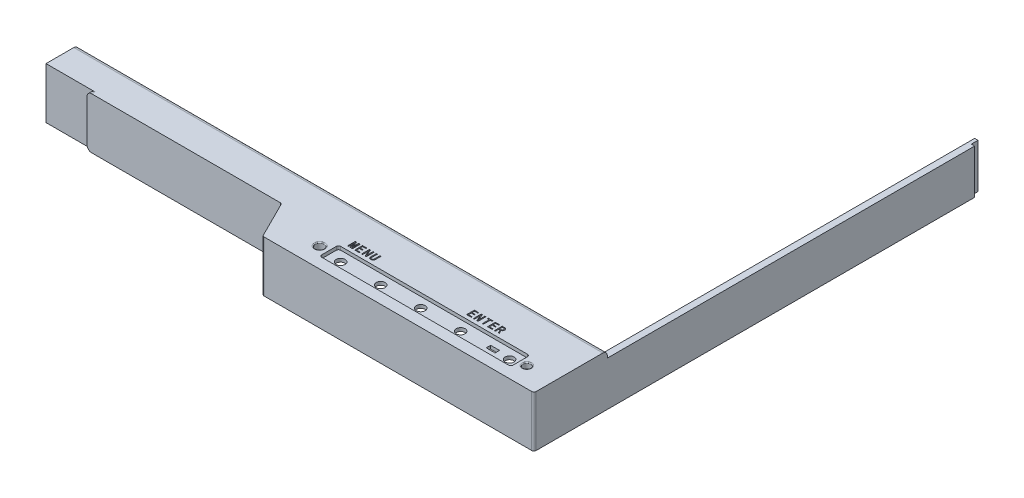
from build123d import *

# Parameters (mm, degrees)
SKETCH_2_W           = 614.8
SKETCH_2_H           = 187.25
SKETCH_2_W_2         = 608.8
SKETCH_2_H_2         = 181.25
EXTRUDE_2_DEPTH      = 20
EXTRUDE_START        = -20
EXTRUDE_3_DEPTH      = 20
EXTRUDE_1_DEPTH      = 3
FILLET_1_R           = 2
CUT_EXTRUDE_5_DEPTH  = 20
SKETCH_11_W          = 614.8
SKETCH_11_H          = 20
CUT_EXTRUDE_6_DEPTH  = 3
SKETCH_12_W          = 14.7
SKETCH_12_H          = 24.983883295
SKETCH_12_R          = 1.525
EXTRUDE_2_2_DEPTH    = 3
SKETCH_13_R          = 3
CUT_EXTRUDE_7_DEPTH  = 1
SKETCH_14_R          = 3
CUT_EXTRUDE_8_DEPTH  = 1
FILLET_2_R           = 1
CUT_EXTRUDE_9_REACH  = 367.952
SKETCH_15_R          = 2
SKETCH_15_R_2        = 1.75
FILLET_3_R           = 0.4
CUT_EXTRUDE_10_DEPTH = 0.5
SKETCH_17_W          = 307.4
SKETCH_17_H          = 31.646239737
CUT_EXTRUDE_11_DEPTH = 369.137640844
SKETCH_18_W          = 1.5
SKETCH_18_H          = 3
CUT_EXTRUDE_12_DEPTH = 366.951858311
FILLET_4_R           = 1
FILLET_6_R           = 1
SKETCH_20_W          = 4
SKETCH_20_H          = 2
CUT_EXTRUDE_14_DEPTH = 2
SKETCH_21_W          = 110
SKETCH_21_H          = 10
CUT_EXTRUDE_15_DEPTH = 0.5
SKETCH_22_W          = 86
SKETCH_22_H          = 8.509363598
CUT_EXTRUDE_16_DEPTH = 1.5
FILLET_7_R           = 1
SKETCH_23_W          = 69.4
SKETCH_23_H          = 23
CUT_EXTRUDE_17_DEPTH = 20
SKETCH_24_W          = 20
SKETCH_24_H          = 23
CUT_EXTRUDE_18_DEPTH = 1.5
FILLET_8_R           = 2


# Read off the part's stored shape, not the designer's step: 拉伸-薄壁3
with BuildPart() as part:
    # 草图2 → Extrude 2 (new body)
    with BuildSketch(Plane(origin=(0, 0, 0), x_dir=(1, 0, 0), z_dir=(0, 1, 0))):
        with Locations((0, -86.925)):
            Rectangle(SKETCH_2_W, SKETCH_2_H)
        with Locations((0, -86.925)):
            Rectangle(SKETCH_2_W_2, SKETCH_2_H_2, mode=Mode.SUBTRACT)
    extrude(amount=EXTRUDE_2_DEPTH)

    # 拉伸-薄壁3 outline → 拉伸-薄壁3 (add)
    with BuildSketch(Plane(origin=(0, 20, 0), x_dir=(1, 0, 0), z_dir=(0, 1, 0)).offset(EXTRUDE_START)):
        Polygon((304.4, -180.55), (304.4, -194.55), (187.254101966, -194.55), (180.254101966, -180.55), (176.9, -180.55), (185.4, -197.55), (307.4, -197.55), (307.4, -180.55), align=None)
    extrude(amount=EXTRUDE_3_DEPTH)

    # 草图8 → 凸台-拉伸1 (add)
    with BuildSketch(Plane(origin=(0, 20, 0), x_dir=(1, 0, 0), z_dir=(0, 1, 0))):
        Polygon((-307.4, -180.55), (176.9, -180.55), (185.4, -197.55), (307.4, -197.55), (307.4, -179.55), (307.4, -164.55), (-307.4, -164.55), align=None)
    extrude(amount=EXTRUDE_1_DEPTH)

    # 圆角1
    fillet_1_edges = [part.edges().sort_by_distance(p)[0] for p in [
        (0, 23, 164.55),
    ]]
    fillet(fillet_1_edges, radius=FILLET_1_R)

    # 草图10 → 切除-拉伸5 (cut)
    with BuildSketch(Plane.XZ):
        Polygon((304.4, 180.55), (304.4, 177.55), (178.754101966, 177.55), (180.254101966, 180.55), align=None)
    extrude(amount=-CUT_EXTRUDE_5_DEPTH, mode=Mode.SUBTRACT)

    # 草图11 → 切除-拉伸6 (cut)
    with BuildSketch(Plane(origin=(0, 0, -6.7), x_dir=(-1, 0, 0), z_dir=(0, 0, -1))):
        with Locations((0, 10)):
            Rectangle(SKETCH_11_W, SKETCH_11_H)
    extrude(amount=-CUT_EXTRUDE_6_DEPTH, mode=Mode.SUBTRACT)

    # 草图12 → Extrude 2 2 (add)
    # profile 1 of 2: a face of its own
    with BuildSketch(Plane(origin=(0, 5, 0), x_dir=(-1, 0, 0), z_dir=(0, -1, 0))):
        with Locations((-297.05, -115.391941648)):
            Rectangle(SKETCH_12_W, SKETCH_12_H)
        with Locations(Location((-294.2, -108.9, 0), (0, 0, 90))):
            Circle(SKETCH_12_R, mode=Mode.SUBTRACT)
        with Locations(Location((-294.2, -122.6, 0), (0, 0, 90))):
            Circle(SKETCH_12_R, mode=Mode.SUBTRACT)
    # profile 2 of 2: a face of its own
    with BuildSketch(Plane(origin=(0, 5, 0), x_dir=(-1, 0, 0), z_dir=(0, -1, 0))):
        with Locations((297.05, -115.391941648)):
            Rectangle(SKETCH_12_W, SKETCH_12_H)
        with Locations(Location((295.175964255, -118.852260737, 0), (0, 0, 270))):
            Circle(SKETCH_12_R, mode=Mode.SUBTRACT)
        with Locations(Location((294.2, -108.9, 0), (0, 0, 270))):
            Circle(SKETCH_12_R, mode=Mode.SUBTRACT)
    extrude(amount=EXTRUDE_2_2_DEPTH)

    # 草图13 → 切除-拉伸7 (cut)
    with BuildSketch(Plane.XZ.offset(-2)):
        with Locations(Location((294.2, 108.9, 0), (0, 0, 270))):
            Circle(SKETCH_13_R)
        with Locations(Location((-294.2, 108.9, 0), (0, 0, 270))):
            Circle(SKETCH_13_R)
    extrude(amount=-CUT_EXTRUDE_7_DEPTH, mode=Mode.SUBTRACT)

    # 草图14 → 切除-拉伸8 (cut)
    with BuildSketch(Plane(origin=(0, 5, 0), x_dir=(1, 0, 0), z_dir=(0, 1, 0))):
        with Locations(Location((294.2, -122.6, 0), (0, 0, 270))):
            Circle(SKETCH_14_R)
        with Locations(Location((-295.175964255, -118.852260737, 0), (0, 0, 270))):
            Circle(SKETCH_14_R)
    extrude(amount=-CUT_EXTRUDE_8_DEPTH, mode=Mode.SUBTRACT)

    # 圆角2
    fillet_2_edges = [part.edges().sort_by_distance(p)[0] for p in [
        (289.7, 3.5, 102.9),
        (304.4, 3.5, 102.9),
        (304.4, 3.5, 127.883883295),
        (289.7, 3.5, 127.883883295),
        (-304.4, 3.5, 127.883883295),
        (-304.4, 3.5, 102.9),
        (-289.7, 3.5, 102.9),
        (-289.7, 3.5, 127.883883295),
    ]]
    fillet(fillet_2_edges, radius=FILLET_2_R)

    # 草图15 → 切除-拉伸9 (cut, up to next)
    with BuildSketch(Plane.XZ.offset(-20), mode=Mode.PRIVATE) as cut_extrude_9_sk1:
        with Locations(Location((287.45, 188.55, 0), (0, 0, 270))):
            Circle(SKETCH_15_R)
    cut_extrude_9_tool1 = extrude(cut_extrude_9_sk1.sketch, amount=-CUT_EXTRUDE_9_REACH, mode=Mode.PRIVATE) & part.part
    # 草图15 → 切除-拉伸9 (cut, up to next)
    with BuildSketch(Plane.XZ.offset(-20), mode=Mode.PRIVATE) as cut_extrude_9_sk2:
        with Locations(Location((265.45, 188.55, 0), (0, 0, 270))):
            Circle(SKETCH_15_R)
    cut_extrude_9_tool2 = extrude(cut_extrude_9_sk2.sketch, amount=-CUT_EXTRUDE_9_REACH, mode=Mode.PRIVATE) & part.part
    # 草图15 → 切除-拉伸9 (cut, up to next)
    with BuildSketch(Plane.XZ.offset(-20), mode=Mode.PRIVATE) as cut_extrude_9_sk3:
        with Locations(Location((247.45, 188.55, 0), (0, 0, 270))):
            Circle(SKETCH_15_R)
    cut_extrude_9_tool3 = extrude(cut_extrude_9_sk3.sketch, amount=-CUT_EXTRUDE_9_REACH, mode=Mode.PRIVATE) & part.part
    # 草图15 → 切除-拉伸9 (cut, up to next)
    with BuildSketch(Plane.XZ.offset(-20), mode=Mode.PRIVATE) as cut_extrude_9_sk4:
        with Locations(Location((229.45, 188.55, 0), (0, 0, 270))):
            Circle(SKETCH_15_R)
    cut_extrude_9_tool4 = extrude(cut_extrude_9_sk4.sketch, amount=-CUT_EXTRUDE_9_REACH, mode=Mode.PRIVATE) & part.part
    # 草图15 → 切除-拉伸9 (cut, up to next)
    with BuildSketch(Plane.XZ.offset(-20), mode=Mode.PRIVATE) as cut_extrude_9_sk5:
        with Locations(Location((211.45, 188.55, 0), (0, 0, 270))):
            Circle(SKETCH_15_R)
    cut_extrude_9_tool5 = extrude(cut_extrude_9_sk5.sketch, amount=-CUT_EXTRUDE_9_REACH, mode=Mode.PRIVATE) & part.part
    # 草图15 → 切除-拉伸9 (cut, up to next)
    with BuildSketch(Plane.XZ.offset(-20), mode=Mode.PRIVATE) as cut_extrude_9_sk6:
        with Locations(Location((202, 188.55, 0), (0, 0, 270))):
            Circle(SKETCH_15_R)
    cut_extrude_9_tool6 = extrude(cut_extrude_9_sk6.sketch, amount=-CUT_EXTRUDE_9_REACH, mode=Mode.PRIVATE) & part.part
    # 草图15 → 切除-拉伸9 (cut, up to next)
    with BuildSketch(Plane.XZ.offset(-20), mode=Mode.PRIVATE) as cut_extrude_9_sk7:
        with Locations(Location((295.2, 188.55, 0), (0, 0, 270))):
            Circle(SKETCH_15_R_2)
    cut_extrude_9_tool7 = extrude(cut_extrude_9_sk7.sketch, amount=-CUT_EXTRUDE_9_REACH, mode=Mode.PRIVATE) & part.part
    add(cut_extrude_9_tool1.solids().sort_by_distance((287.45, 20, 188.55))[0], mode=Mode.SUBTRACT)
    add(cut_extrude_9_tool2.solids().sort_by_distance((265.45, 20, 188.55))[0], mode=Mode.SUBTRACT)
    add(cut_extrude_9_tool3.solids().sort_by_distance((247.45, 20, 188.55))[0], mode=Mode.SUBTRACT)
    add(cut_extrude_9_tool4.solids().sort_by_distance((229.45, 20, 188.55))[0], mode=Mode.SUBTRACT)
    add(cut_extrude_9_tool5.solids().sort_by_distance((211.45, 20, 188.55))[0], mode=Mode.SUBTRACT)
    add(cut_extrude_9_tool6.solids().sort_by_distance((202, 20, 188.55))[0], mode=Mode.SUBTRACT)
    add(cut_extrude_9_tool7.solids().sort_by_distance((295.2, 20, 188.55))[0], mode=Mode.SUBTRACT)

    # 圆角3
    fillet_3_edges = [part.edges().sort_by_distance(p)[0] for p in [
        (202, 23, 190.55),
        (211.45, 23, 190.55),
        (229.45, 23, 190.55),
        (247.45, 23, 190.55),
        (295.2, 23, 190.3),
        (265.45, 23, 190.55),
        (287.45, 23, 190.55),
    ]]
    fillet(fillet_3_edges, radius=FILLET_3_R)

    # 草图16 → 切除-拉伸10 (cut)
    # profile 1 of 9: a face of its own
    with BuildSketch(Plane(origin=(0, 23, 0), x_dir=(1, 0, 0), z_dir=(0, 1, 0))):
        Polygon((210.455246537, -182.25001631), (210.045889812, -182.25001631), (210.045889812, -179.752940287), (210.00495414, -179.752940287), (209.51372607, -182.25001631), (209.18624069, -182.25001631), (208.695012619, -179.752940287), (208.654076947, -179.752940287), (208.654076947, -182.25001631), (208.244720222, -182.25001631), (208.244720222, -178.75001631), (208.879223146, -178.75001631), (209.329515543, -181.062881807), (209.370451216, -181.062881807), (209.820743613, -178.75001631), (210.455246537, -178.75001631), align=None)
    # profile 2 of 9: a face of its own
    with BuildSketch(Plane(origin=(0, 23, 0), x_dir=(1, 0, 0), z_dir=(0, 1, 0))):
        Polygon((213.57863835, -182.25001631), (211.490919052, -182.25001631), (211.490919052, -178.75001631), (213.476299169, -178.75001631), (213.476299169, -179.138905199), (211.961679286, -179.138905199), (211.961679286, -180.223700521), (213.353492152, -180.223700521), (213.353492152, -180.61258941), (211.961679286, -180.61258941), (211.961679286, -181.861127421), (213.57863835, -181.861127421), align=None)
    # profile 3 of 9: a face of its own
    with BuildSketch(Plane(origin=(0, 23, 0), x_dir=(1, 0, 0), z_dir=(0, 1, 0))):
        Polygon((216.681562327, -182.25001631), (216.169866421, -182.25001631), (215.044135426, -179.712004614), (215.02366759, -179.712004614), (215.02366759, -182.25001631), (214.552907356, -182.25001631), (214.552907356, -178.75001631), (215.064603263, -178.75001631), (216.190334257, -181.288028006), (216.210802093, -181.288028006), (216.210802093, -178.75001631), (216.681562327, -178.75001631), align=None)
    # profile 4 of 9: a face of its own
    with BuildSketch(Plane(origin=(0, 23, 0), x_dir=(1, 0, 0), z_dir=(0, 1, 0))):
        with BuildLine():
            add(Edge.make_bspline(
                [(219.845889812, -181.226624497), (219.845252206, -181.26657941), (219.844010158, -181.344410977), (219.83174303, -181.458027489), (219.811050116, -181.564832134), (219.784229849, -181.666173277), (219.74780038, -181.760528428), (219.703605982, -181.848806704), (219.650886688, -181.930118904), (219.591048267, -182.005557417), (219.52284297, -182.07408124), (219.443451762, -182.131577498), (219.355879434, -182.181338853), (219.258642753, -182.221127399), (219.152711126, -182.253521203), (219.036927883, -182.27444253), (218.91230334, -182.288655471), (218.826079459, -182.290170024), (218.781562327, -182.290951983)],
                knots=[0, 0, 0, 0, 1.114057318, 2.17016686, 3.181914251, 4.146156195, 5.0898066, 5.997508409, 6.894781419, 7.787392663, 8.679419473, 9.581522874, 10.512482426, 11.482322563, 12.505662445, 13.596199728, 14.758925122, 16, 16, 16, 16], degree=3))
            add(Edge.make_bspline(
                [(218.781562327, -182.290951983), (218.737044917, -182.290170803), (218.650820497, -182.28865776), (218.526199723, -182.274434261), (218.410403468, -182.253549383), (218.304292742, -182.220962702), (218.206696097, -182.181487541), (218.118958429, -182.131838581), (218.040208413, -182.073576257), (217.97133088, -182.00582912), (217.911401333, -181.930310717), (217.859662673, -181.848565995), (217.815191731, -181.760581167), (217.779202502, -181.666019353), (217.750813146, -181.56506842), (217.731734086, -181.457906489), (217.719017648, -181.344431166), (217.717839596, -181.266586258), (217.717234842, -181.226624497)],
                knots=[0, 0, 0, 0, 1.240869508, 2.403402497, 3.49375932, 4.516929862, 5.493116046, 6.423921546, 7.320215534, 8.217118663, 9.1095822, 10.00290763, 10.910459234, 11.853953486, 12.819913796, 13.830192254, 14.886127034, 16, 16, 16, 16], degree=3))
            Line((217.717234842, -181.226624497), (217.717234842, -178.75001631))
            Line((217.717234842, -178.75001631), (218.187995075, -178.75001631))
            Line((218.187995075, -178.75001631), (218.187995075, -181.226624497))
            add(Edge.make_bspline(
                [(218.187995075, -181.226624497), (218.188213264, -181.254707344), (218.188634992, -181.308987667), (218.19804271, -181.38732264), (218.208911789, -181.460438576), (218.227884974, -181.527374162), (218.249770608, -181.589451465), (218.279228246, -181.644528783), (218.311695024, -181.69517624), (218.350847139, -181.73868231), (218.393011254, -181.777674194), (218.439623097, -181.810333522), (218.488318688, -181.839601933), (218.541401603, -181.861878208), (218.596678614, -181.880803398), (218.655678549, -181.891924934), (218.717333369, -181.901372295), (218.759789268, -181.901828919), (218.781562327, -181.902063094)],
                knots=[0, 0, 0, 0, 1.315659406, 2.542990672, 3.696132648, 4.776878556, 5.800314007, 6.775421457, 7.698841572, 8.613938634, 9.511376441, 10.385998327, 11.278101667, 12.169575324, 13.080058421, 14.011877908, 14.98041258, 16, 16, 16, 16], degree=3))
            add(Edge.make_bspline(
                [(218.781562327, -181.902063094), (218.803335384, -181.901828918), (218.845791278, -181.90137229), (218.907446131, -181.891924951), (218.966445947, -181.880803339), (219.021723386, -181.86187842), (219.074804742, -181.839601157), (219.123506092, -181.810336398), (219.17009666, -181.77766358), (219.212342385, -181.738723442), (219.251275022, -181.694913624), (219.284938523, -181.644991771), (219.313088391, -181.589183633), (219.33539899, -181.527431492), (219.353888725, -181.460334707), (219.366376777, -181.387469449), (219.374130456, -181.308918884), (219.374788808, -181.254692632), (219.375129578, -181.226624497)],
                knots=[0, 0, 0, 0, 1.019461184, 1.987875941, 2.91958006, 3.82995043, 4.721313713, 5.613306601, 6.4878202, 7.385146895, 8.300130658, 9.230025348, 10.199598843, 11.222907583, 12.303519683, 13.45852564, 14.684503486, 16, 16, 16, 16], degree=3))
            Line((219.375129578, -181.226624497), (219.375129578, -178.75001631))
            Line((219.375129578, -178.75001631), (219.845889812, -178.75001631))
            Line((219.845889812, -178.75001631), (219.845889812, -181.226624497))
        make_face()
    # profile 5 of 9: a face of its own
    with BuildSketch(Plane(origin=(0, 23, 0), x_dir=(1, 0, 0), z_dir=(0, 1, 0))):
        Polygon((263.880392736, -182.25001631), (261.792673438, -182.25001631), (261.792673438, -178.75001631), (263.778053555, -178.75001631), (263.778053555, -179.138905199), (262.263433672, -179.138905199), (262.263433672, -180.223700521), (263.655246537, -180.223700521), (263.655246537, -180.61258941), (262.263433672, -180.61258941), (262.263433672, -181.861127421), (263.880392736, -181.861127421), align=None)
    # profile 6 of 9: a face of its own
    with BuildSketch(Plane(origin=(0, 23, 0), x_dir=(1, 0, 0), z_dir=(0, 1, 0))):
        Polygon((266.983316713, -182.25001631), (266.471620806, -182.25001631), (265.345889812, -179.712004614), (265.325421976, -179.712004614), (265.325421976, -182.25001631), (264.854661742, -182.25001631), (264.854661742, -178.75001631), (265.366357649, -178.75001631), (266.492088643, -181.288028006), (266.512556479, -181.288028006), (266.512556479, -178.75001631), (266.983316713, -178.75001631), align=None)
    # profile 7 of 9: a face of its own
    with BuildSketch(Plane(origin=(0, 23, 0), x_dir=(1, 0, 0), z_dir=(0, 1, 0))):
        Polygon((270.127176362, -179.138905199), (269.308462912, -179.138905199), (269.308462912, -182.25001631), (268.837702678, -182.25001631), (268.837702678, -179.138905199), (268.018989228, -179.138905199), (268.018989228, -178.75001631), (270.127176362, -178.75001631), align=None)
    # profile 8 of 9: a face of its own
    with BuildSketch(Plane(origin=(0, 23, 0), x_dir=(1, 0, 0), z_dir=(0, 1, 0))):
        Polygon((273.311971684, -182.25001631), (271.224252385, -182.25001631), (271.224252385, -178.75001631), (273.209632502, -178.75001631), (273.209632502, -179.138905199), (271.695012619, -179.138905199), (271.695012619, -180.223700521), (273.086825485, -180.223700521), (273.086825485, -180.61258941), (271.695012619, -180.61258941), (271.695012619, -181.861127421), (273.311971684, -181.861127421), align=None)
    # profile 9 of 9: a face of its own
    with BuildSketch(Plane(origin=(0, 23, 0), x_dir=(1, 0, 0), z_dir=(0, 1, 0))):
        with BuildLine():
            Line((276.537702678, -182.25001631), (276.046474608, -182.25001631))
            Line((276.046474608, -182.25001631), (275.309632502, -180.735396427))
            Line((275.309632502, -180.735396427), (274.77746876, -180.735396427))
            Line((274.77746876, -180.735396427), (274.77746876, -182.25001631))
            Line((274.77746876, -182.25001631), (274.306708526, -182.25001631))
            Line((274.306708526, -182.25001631), (274.306708526, -178.75001631))
            Line((274.306708526, -178.75001631), (275.330100339, -178.75001631))
            add(Edge.make_bspline(
                [(275.330100339, -178.75001631), (275.370043949, -178.750808674), (275.448306057, -178.752361163), (275.562933382, -178.762609509), (275.671554742, -178.781798219), (275.774391114, -178.807676178), (275.871996003, -178.839671602), (275.963156448, -178.881313091), (276.049277426, -178.928838106), (276.129267968, -178.984137422), (276.201669301, -179.047663023), (276.265055585, -179.12087346), (276.317761687, -179.203859655), (276.361604812, -179.295928751), (276.394287078, -179.397275333), (276.418823021, -179.507605458), (276.433067308, -179.62723211), (276.43458276, -179.710197725), (276.435363497, -179.752940287)],
                knots=[0, 0, 0, 0, 1.124851401, 2.203938021, 3.236923468, 4.227547377, 5.188384515, 6.124748074, 7.04535131, 7.955333121, 8.85768773, 9.750678987, 10.67246398, 11.61778816, 12.61462837, 13.664292026, 14.796680505, 16, 16, 16, 16], degree=3))
            add(Edge.make_bspline(
                [(276.435363497, -179.752940287), (276.434881136, -179.786070186), (276.433939902, -179.850716864), (276.423746773, -179.944702375), (276.408077992, -180.032943527), (276.386156988, -180.115509227), (276.357554084, -180.192386348), (276.321454986, -180.263247772), (276.279977053, -180.328858136), (276.216361818, -180.406599176), (276.128497865, -180.490741983), (276.013784821, -180.574027726), (275.890791872, -180.637146831), (275.803396346, -180.66175337), (275.7599249, -180.673992919)],
                knots=[0, 0, 0, 0, 0.960252019, 1.873748618, 2.737466876, 3.556786617, 4.347431233, 5.110891588, 5.858830743, 6.593445102, 8.018399741, 9.372640647, 10.693124067, 12, 12, 12, 12], degree=3))
            Line((275.7599249, -180.673992919), (276.537702678, -182.25001631))
        make_face()
        with BuildLine():
            add(Edge.make_bspline(
                [(275.964603263, -179.752940287), (275.963901801, -179.729678921), (275.962533263, -179.684296457), (275.955343014, -179.61794112), (275.941375252, -179.555608981), (275.923001694, -179.496791516), (275.897018022, -179.442783197), (275.868175174, -179.391350425), (275.831523502, -179.345044722), (275.790864674, -179.30136271), (275.743498431, -179.262591838), (275.689662448, -179.228684181), (275.628815192, -179.201036865), (275.561419604, -179.178394106), (275.487677957, -179.160144464), (275.407026303, -179.147571861), (275.319637643, -179.139915934), (275.2591114, -179.139250084), (275.227761157, -179.138905199)],
                knots=[0, 0, 0, 0, 1.018423225, 1.986923476, 2.915383729, 3.810714658, 4.676600435, 5.533969095, 6.385612358, 7.253966558, 8.141821118, 9.056210967, 10.031005151, 11.059229177, 12.164336364, 13.351610032, 14.628236891, 16, 16, 16, 16], degree=3))
            Line((275.227761157, -179.138905199), (274.77746876, -179.138905199))
            Line((274.77746876, -179.138905199), (274.77746876, -180.346507538))
            Line((274.77746876, -180.346507538), (275.350568175, -180.346507538))
            add(Edge.make_bspline(
                [(275.350568175, -180.346507538), (275.390381919, -180.344999119), (275.468307844, -180.342046747), (275.580851549, -180.31614328), (275.685934252, -180.274750832), (275.766448699, -180.226508909), (275.824709867, -180.178642397), (275.862051406, -180.135301745), (275.894271624, -180.086538467), (275.919842372, -180.03117839), (275.94046682, -179.970247821), (275.954618266, -179.903080239), (275.962821987, -179.829962802), (275.963994993, -179.779241924), (275.964603263, -179.752940287)],
                knots=[0, 0, 0, 0, 1.47184772, 2.880791526, 4.249240139, 5.638178403, 6.335067569, 7.030952029, 7.746845966, 8.491482783, 9.28109559, 10.123026367, 11.02668324, 12, 12, 12, 12], degree=3))
        make_face(mode=Mode.SUBTRACT)
    extrude(amount=-CUT_EXTRUDE_10_DEPTH, mode=Mode.SUBTRACT)

    # 草图17 → 切除-拉伸11 (cut, through all)
    with BuildSketch(Plane(origin=(0, 0, -3.7), x_dir=(-1, 0, 0), z_dir=(0, 0, -1))):
        with Locations((153.7, 15.823119869)):
            Rectangle(SKETCH_17_W, SKETCH_17_H)
    extrude(amount=-CUT_EXTRUDE_11_DEPTH, mode=Mode.SUBTRACT)

    # 草图18 → 切除-拉伸12 (cut, through all)
    with BuildSketch(Plane(origin=(0, 20, 0), x_dir=(1, 0, 0), z_dir=(0, 1, 0))):
        with Locations((306.65, 2.2)):
            Rectangle(SKETCH_18_W, SKETCH_18_H)
    extrude(amount=-CUT_EXTRUDE_12_DEPTH, mode=Mode.SUBTRACT)

    # 圆角4
    fillet_4_edges = [part.edges().sort_by_distance(p)[0] for p in [
        (185.4, 11.5, 197.55),
        (176.9, 11.5, 180.55),
    ]]
    fillet(fillet_4_edges, radius=FILLET_4_R)

    # 圆角6
    fillet_6_edges = [part.edges().sort_by_distance(p)[0] for p in [
        (307.4, 11.5, 197.55),
    ]]
    fillet(fillet_6_edges, radius=FILLET_6_R)

    # 草图20 → 切除-拉伸14 (cut)
    with BuildSketch(Plane.XZ.offset(-20)):
        with Locations((279.65, 188.280507493)):
            Rectangle(SKETCH_20_W, SKETCH_20_H)
    extrude(amount=-CUT_EXTRUDE_14_DEPTH, mode=Mode.SUBTRACT)

    # 草图21 → 切除-拉伸15 (cut)
    with BuildSketch(Plane(origin=(0, 0, 194.55), x_dir=(-1, 0, 0), z_dir=(0, 0, -1))):
        with Locations((-245.08399158, 13.260623917)):
            Rectangle(SKETCH_21_W, SKETCH_21_H)
    extrude(amount=-CUT_EXTRUDE_15_DEPTH, mode=Mode.SUBTRACT)

    # 草图22 → 切除-拉伸16 (cut)
    with BuildSketch(Plane(origin=(0, 23, 0), x_dir=(1, 0, 0), z_dir=(0, 1, 0))):
        with Locations((248.912394303, -188.239356729)):
            Rectangle(SKETCH_22_W, SKETCH_22_H)
    extrude(amount=-CUT_EXTRUDE_16_DEPTH, mode=Mode.SUBTRACT)

    # 圆角7
    fillet_7_edges = [part.edges().sort_by_distance(p)[0] for p in [
        (205.912394303, 22.25, 192.494038528),
        (205.912394303, 22.25, 183.98467493),
        (291.912394303, 22.25, 183.98467493),
        (291.912394303, 22.25, 192.494038528),
    ]]
    fillet(fillet_7_edges, radius=FILLET_7_R)

    # 草图23 → 切除-拉伸17 (cut)
    with BuildSketch(Plane.XY.offset(180.55)):
        with Locations((34.7, 11.5)):
            Rectangle(SKETCH_23_W, SKETCH_23_H)
    extrude(amount=-CUT_EXTRUDE_17_DEPTH, mode=Mode.SUBTRACT)

    # 草图24 → 切除-拉伸18 (cut)
    with BuildSketch(Plane.XY.offset(180.55)):
        with Locations((79.4, 11.5)):
            Rectangle(SKETCH_24_W, SKETCH_24_H)
    extrude(amount=-CUT_EXTRUDE_18_DEPTH, mode=Mode.SUBTRACT)

    # 圆角8
    fillet_8_edges = [part.edges().sort_by_distance(p)[0] for p in [
        (89.4, 23, 179.8),
        (89.4, 0, 179.8),
    ]]
    fillet(fillet_8_edges, radius=FILLET_8_R)


solid = part.part
